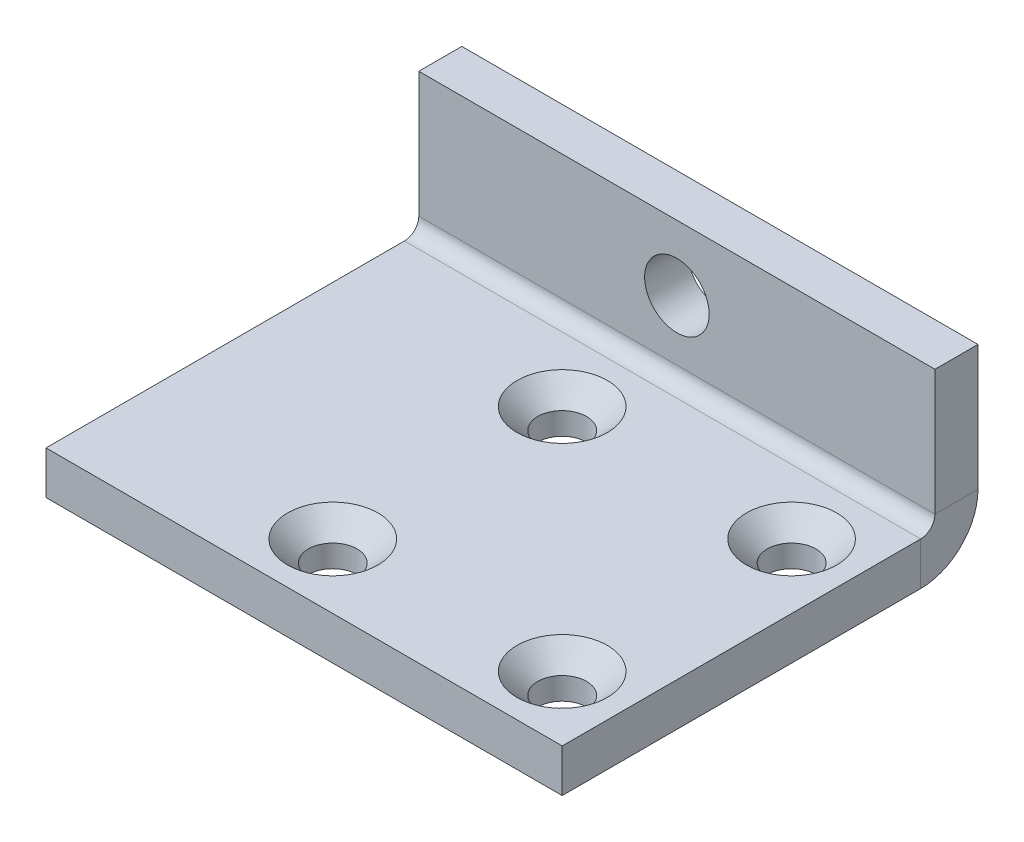
from build123d import *

# Parameters (mm, degrees)
T_LE_DE_BASE_PLI_E1_DEPTH                   = 36
FRAISAGE_POUR_VIS_T_TE_FRAIS_E_M31_AT_COUNT = 2
FRAISAGE_POUR_VIS_T_TE_FRAIS_E_M31_AT_PITCH = 16
FRAISAGE_POUR_VIS_T_TE_FRAIS_E_M31_2_COUNT  = 2
FRAISAGE_POUR_VIS_T_TE_FRAIS_E_M31_2_PITCH  = 22.627416998
FRAISAGE_POUR_VIS_T_TE_FRAIS_E_M31_3_COUNT  = 2
FRAISAGE_POUR_VIS_T_TE_FRAIS_E_M31_3_PITCH  = 16
D_GAGEMENT_M41_D                            = 4.5


# Sheet-metal steps are written as plain solids
with BuildPart() as part:
    # Esquisse1 → Tôle de base pliée1 (new body)
    with BuildSketch(Plane(origin=(0, 0, 0), x_dir=(0, 0, -1), z_dir=(1, 0, 0))):
        with BuildLine():
            Line((0, 12.75), (0, 4))
            ThreePointArc((0, 4), (-1.171572875, 1.171572875), (-4, 0))
            Line((-4, 0), (-29, 0))
            Line((-29, 0), (-29, 3))
            Line((-29, 3), (-4, 3))
            ThreePointArc((-4, 3), (-3.292893219, 3.292893219), (-3, 4))
            Line((-3, 4), (-3, 12.75))
            Line((-3, 12.75), (0, 12.75))
        make_face()
    extrude(amount=T_LE_DE_BASE_PLI_E1_DEPTH)

    # Esquisse7 → Fraisage pour vis à tête fraisée M31 (revolve, cut)
    with BuildSketch(Plane(origin=(15.5, 3, 24.5), x_dir=(0, 0, 1), z_dir=(1, 0, 0))):
        Polygon((0, 0), (0, 3), (1.7, 3), (1.7, 1.45), (3.15, 0), align=None)
    fraisage_pour_vis_t_te_frais_e_m31 = revolve(axis=Axis((15.5, 9.35, 24.5), (0, -1, 0)), mode=Mode.SUBTRACT)

    # Fraisage pour vis à tête fraisée M31 at: Fraisage pour vis à tête fraisée M31 ×2
    with Locations(*[(0, 0, -i * FRAISAGE_POUR_VIS_T_TE_FRAIS_E_M31_AT_PITCH) for i in range(1, FRAISAGE_POUR_VIS_T_TE_FRAIS_E_M31_AT_COUNT)]):
        add(fraisage_pour_vis_t_te_frais_e_m31, mode=Mode.SUBTRACT)

    # Fraisage pour vis _ t_te frais_e M31 2: Fraisage pour vis à tête fraisée M31 ×2
    with Locations(*[Vector(0.7071067811865476, 0, -0.7071067811865476) * (i * FRAISAGE_POUR_VIS_T_TE_FRAIS_E_M31_2_PITCH) for i in range(1, FRAISAGE_POUR_VIS_T_TE_FRAIS_E_M31_2_COUNT)]):
        add(fraisage_pour_vis_t_te_frais_e_m31, mode=Mode.SUBTRACT)

    # Fraisage pour vis _ t_te frais_e M31 3: Fraisage pour vis à tête fraisée M31 ×2
    with Locations(*[(i * FRAISAGE_POUR_VIS_T_TE_FRAIS_E_M31_3_PITCH, 0, 0) for i in range(1, FRAISAGE_POUR_VIS_T_TE_FRAIS_E_M31_3_COUNT)]):
        add(fraisage_pour_vis_t_te_frais_e_m31, mode=Mode.SUBTRACT)

    # Dégagement M41 (through all)
    with Locations(Plane.XY.offset(3)):
        with Locations((18, 8.2)):
            Hole(D_GAGEMENT_M41_D / 2)


solid = part.part
